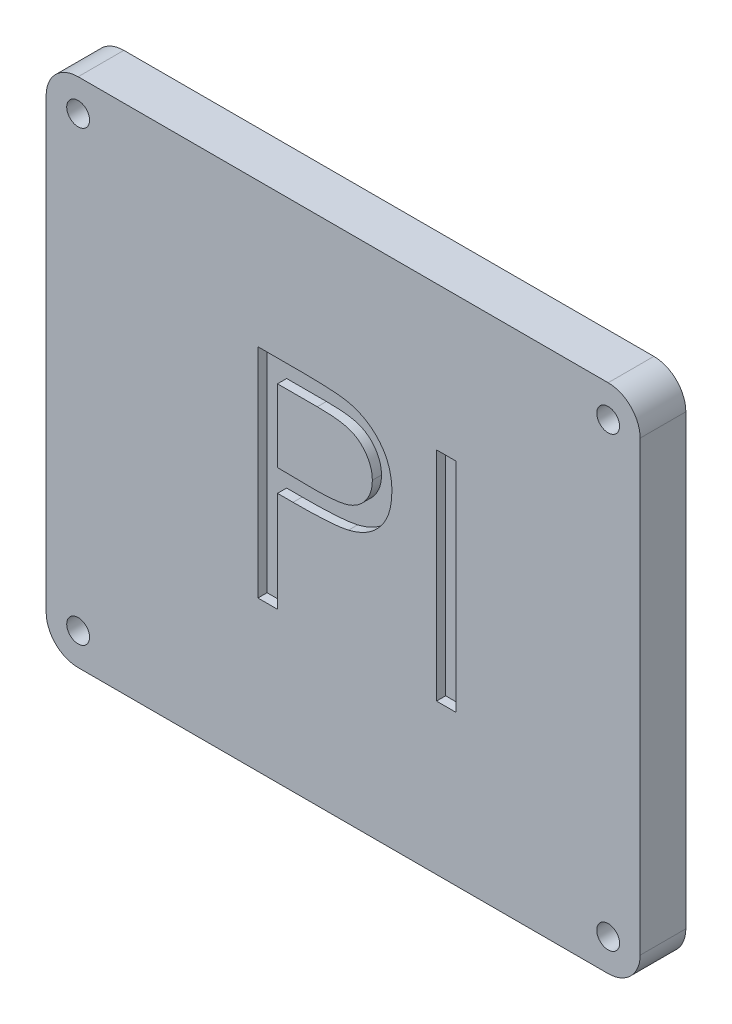
from build123d import *

# Parameters (mm, degrees)
BOSS_EXTRU_1_OUTLINE_W  = 65
BOSS_EXTRU_1_OUTLINE_H  = 56
BOSS_EXTRU_1_OUTLINE_R  = 1.25
BOSS_EXTRU_1_DEPTH      = 5
CONG_3_R                = 3.5
ESQUISSE2_W             = 2.137019231
ESQUISSE2_H             = 23.8125
ENL_V_MAT_EXTRU_1_DEPTH = 1


# Read off the part's stored shape, not the designer's step: Boss.-Extru.1
with BuildPart() as part:
    # Boss.-Extru.1 outline → Boss.-Extru.1 (new body)
    with BuildSketch(Plane.XY):
        Rectangle(BOSS_EXTRU_1_OUTLINE_W, BOSS_EXTRU_1_OUTLINE_H)
        with Locations((-29, -24.5)):
            Circle(BOSS_EXTRU_1_OUTLINE_R, mode=Mode.SUBTRACT)
        with Locations((29, -24.5)):
            Circle(BOSS_EXTRU_1_OUTLINE_R, mode=Mode.SUBTRACT)
        with Locations((-29, 24.5)):
            Circle(BOSS_EXTRU_1_OUTLINE_R, mode=Mode.SUBTRACT)
        with Locations((29, 24.5)):
            Circle(BOSS_EXTRU_1_OUTLINE_R, mode=Mode.SUBTRACT)
    extrude(amount=BOSS_EXTRU_1_DEPTH)

    # Congé3
    cong_3_edges = [part.edges().sort_by_distance(p)[0] for p in [
        (-32.5, 28, 2.5),
        (32.5, 28, 2.5),
        (32.5, -28, 2.5),
        (-32.5, -28, 2.5),
    ]]
    fillet(cong_3_edges, radius=CONG_3_R)

    # Esquisse2 → Enlèv. mat.-Extru.1 (cut)
    # profile 1 of 2: a face of its own
    with BuildSketch(Plane.XY.offset(5)):
        with BuildLine():
            Line((-9.322744099, 12.249768252), (-4.652784664, 12.249768252))
            add(Edge.make_bspline(
                [(-4.652784664, 12.249768252), (-4.331581892, 12.249415172), (-3.716143116, 12.248738655), (-2.833617469, 12.228227617), (-2.032090545, 12.20083173), (-1.313290632, 12.16285492), (-0.675006107, 12.117974548), (-0.120125194, 12.055027637), (0.355713573, 11.989303126), (0.640827095, 11.922482485), (0.77085566, 11.892008336)],
                knots=[0, 0, 0, 0, 1.415646017, 2.712440637, 3.8905458, 4.950247383, 5.884950622, 6.709939814, 7.411656543, 8, 8, 8, 8], degree=3))
            add(Edge.make_bspline(
                [(0.77085566, 11.892008336), (0.935458095, 11.846955427), (1.260784315, 11.757911225), (1.729557484, 11.579564285), (2.175557754, 11.368094554), (2.600315321, 11.127085249), (2.998610565, 10.846195964), (3.376385951, 10.536812958), (3.730307602, 10.191793179), (4.058385286, 9.815006359), (4.35968007, 9.412777789), (4.61909809, 8.979102974), (4.83631726, 8.521281785), (5.022621303, 8.039632667), (5.156709181, 7.530111002), (5.257721123, 6.996257119), (5.321835447, 6.438128245), (5.32797609, 6.056720932), (5.331102055, 5.86256122)],
                knots=[0, 0, 0, 0, 0.999701418, 1.975846123, 2.934577507, 3.890451536, 4.834027766, 5.787354733, 6.749476667, 7.726910423, 8.712836071, 9.690891519, 10.682875813, 11.679750201, 12.712814741, 13.765529915, 14.8625177, 16, 16, 16, 16], degree=3))
            add(Edge.make_bspline(
                [(5.331102055, 5.86256122), (5.328234861, 5.66676956), (5.322625004, 5.283689954), (5.25529492, 4.723260806), (5.164602009, 4.187694616), (5.025148849, 3.67817889), (4.842502395, 3.197739452), (4.628243964, 2.739034284), (4.369820302, 2.309867231), (4.072879586, 1.908680234), (3.742555345, 1.535096724), (3.380245177, 1.191823926), (2.987411776, 0.880871195), (2.56530359, 0.601541428), (2.109805511, 0.360312098), (1.627825859, 0.144249005), (1.11517528, -0.037209461), (0.760419961, -0.132663986), (0.580050372, -0.181196292)],
                knots=[0, 0, 0, 0, 1.121902311, 2.195077645, 3.232258892, 4.234102512, 5.217864754, 6.176164875, 7.132989551, 8.084763148, 9.034132444, 9.988522005, 10.94243251, 11.903244335, 12.886203696, 13.894208494, 14.929344452, 16, 16, 16, 16], degree=3))
            add(Edge.make_bspline(
                [(0.580050372, -0.181196292), (0.430866189, -0.212921216), (0.103920378, -0.282448234), (-0.434532786, -0.360066485), (-1.061450501, -0.426316947), (-1.775977084, -0.475990758), (-2.577471169, -0.518515586), (-3.466366331, -0.552316368), (-4.444407463, -0.570889123), (-5.126610034, -0.571847017), (-5.482787669, -0.572347133)],
                knots=[0, 0, 0, 0, 0.601384939, 1.31797006, 2.144135048, 3.087295005, 4.142315834, 5.309527816, 6.595305764, 8, 8, 8, 8], degree=3))
            Line((-5.482787669, -0.572347133), (-7.185724869, -0.572347133))
            Line((-7.185724869, -0.572347133), (-7.185724869, -11.562731748))
            Line((-7.185724869, -11.562731748), (-9.322744099, -11.562731748))
            Line((-9.322744099, -11.562731748), (-9.322744099, 12.249768252))
        make_face()
        with BuildLine():
            Line((-7.185724869, 9.807460559), (-7.185724869, 1.869960559))
            Line((-7.185724869, 1.869960559), (-3.016629316, 1.817489105))
            add(Edge.make_bspline(
                [(-3.016629316, 1.817489105), (-2.813066963, 1.817383897), (-2.420094039, 1.817180796), (-1.852429734, 1.844294549), (-1.325770119, 1.875594601), (-0.841732919, 1.921422938), (-0.400099936, 1.986201493), (-0.000134784, 2.051595639), (0.355061194, 2.146201766), (0.770753978, 2.273585505), (1.233963895, 2.490841336), (1.737887752, 2.806186124), (2.16495192, 3.208145942), (2.534510332, 3.660092437), (2.827784252, 4.162870443), (3.042477699, 4.700821602), (3.168623788, 5.268428935), (3.185538784, 5.656832166), (3.194082824, 5.853020956)],
                knots=[0, 0, 0, 0, 1.160613943, 2.240541288, 3.23993089, 4.169200891, 5.011653406, 5.7853311, 6.478053781, 7.106038997, 8.262395093, 9.384106736, 10.481365981, 11.59014053, 12.70357646, 13.786202915, 14.881775077, 16, 16, 16, 16], degree=3))
            add(Edge.make_bspline(
                [(3.194082824, 5.853020956), (3.185492318, 6.044463342), (3.168415456, 6.425027112), (3.041488959, 6.982775465), (2.828201662, 7.515057668), (2.532541618, 8.011535267), (2.173713573, 8.461855522), (1.756659113, 8.853041333), (1.28235996, 9.167513989), (0.841160389, 9.370486852), (0.449266605, 9.49441578), (0.108870592, 9.581126212), (-0.275467747, 9.650356676), (-0.703873532, 9.706414722), (-1.173026277, 9.754403449), (-1.686956598, 9.786965187), (-2.243717635, 9.806025094), (-2.630232412, 9.806970487), (-2.830594159, 9.807460559)],
                knots=[0, 0, 0, 0, 1.120700087, 2.227813068, 3.331159281, 4.466773991, 5.599788987, 6.693661531, 7.80175334, 8.91857717, 9.525282508, 10.207424825, 10.974604443, 11.810962634, 12.737642355, 13.736264703, 14.826523623, 16, 16, 16, 16], degree=3))
            Line((-2.830594159, 9.807460559), (-7.185724869, 9.807460559))
        make_face(mode=Mode.SUBTRACT)
    # profile 2 of 2: a face of its own
    with BuildSketch(Plane.XY.offset(5)):
        with Locations((11.284227055, 0.343518252)):
            Rectangle(ESQUISSE2_W, ESQUISSE2_H)
    extrude(amount=-ENL_V_MAT_EXTRU_1_DEPTH, mode=Mode.SUBTRACT)


solid = part.part
